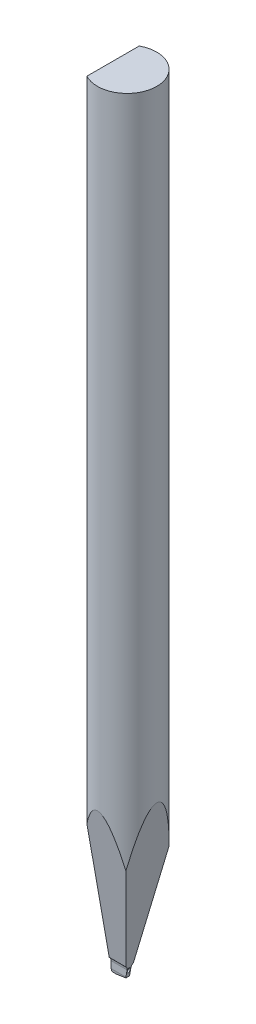
from build123d import *

# Parameters (mm, degrees)
TD_SKETCH_R                             = 0.79248
TL_FEATURE_DEPTH                        = 21.0312
TDF_STD_SKETCH_W                        = 2.09296
TDF_STD_SKETCH_H                        = 2.09296
TDF_STD_FEATURE_DEPTH                   = 22.061040395
ISA_20_STD_FEATURE_DEPTH                = 22.061040395
ISA_20_STD_FEATURE_DEPTH_BACK           = 22.061040395
VW_STD_FEATURE_DEPTH                    = 22.061040395
VW_STD_FEATURE_DEPTH_BACK               = 22.061040395
F_10BA_STD_FEATURE_DEPTH                = 22.061040503
F_10BA_STD_FEATURE_DEPTH_BACK           = 22.061040503
FRO_STD_FEATURE_DEPTH                   = 22.061040395
FRO_STD_FEATURE_DEPTH_BACK              = 22.061040395
C_STD_FEATURE_DEPTH                     = 22.061040395
C_STD_FEATURE_DEPTH_BACK                = 22.061040395
ERW_STD_FEATURE_DEPTH                   = 0.0254
H_STD_FEATURE_REACH                     = 22.896
H_STD_SKETCH_R                          = 0.01905
H_STD_SKETCH_3_R                        = 0.01905
FUNNEL_FINAL_DIAMETRE_STD_FEATURE_DEPTH = 2.499995
FUNNEL_FINAL_DIAMETRE_STD_FEATURE_DRAFT = -22.5
ROUND_BR_STD_FEATURE_START              = -1
ROUND_BR_STD_FEATURE_DEPTH              = 1.009339363
CBRA_STD_FEATURE_DEPTH                  = 0.00635


with BuildPart() as part:
    # TD_sketch → TL_feature (new body)
    with BuildSketch(Plane(origin=(0, 0, 0), x_dir=(1, 0, 0), z_dir=(0, 1, 0))):
        with Locations(Location((0, 0, 0), (0, 0, 270))):
            Circle(TD_SKETCH_R)
    extrude(amount=TL_FEATURE_DEPTH)

    # TDF_STD_sketch → TDF_STD_feature (cut, through all)
    with BuildSketch(Plane(origin=(0, 0, 0), x_dir=(1, 0, 0), z_dir=(0, 1, 0))):
        with Locations((-1.4224, 0)):
            Rectangle(TDF_STD_SKETCH_W, TDF_STD_SKETCH_H)
    extrude(amount=TDF_STD_FEATURE_DEPTH, mode=Mode.SUBTRACT)

    # ISA_20_STD_sketch → ISA_20_STD_feature (cut, two sides: drawn at the far end of the back side and taken through both)
    with BuildSketch(Plane(origin=(0, 0, 0), x_dir=(0, 0, -1), z_dir=(1, 0, 0)).offset(-ISA_20_STD_FEATURE_DEPTH_BACK)):
        Polygon((-12.955177728, 73.256388083), (-3.746467997, 21.0312), (-0.0381, 0), (0.0381, 0), (3.746467997, 21.0312), (12.955177728, 73.256388083), (12.955177728, -32.805303497), (-12.955177728, -32.805303497), align=None)
    extrude(amount=ISA_20_STD_FEATURE_DEPTH + ISA_20_STD_FEATURE_DEPTH_BACK, mode=Mode.SUBTRACT)

    # VW_STD_sketch → VW_STD_feature (cut, two sides: drawn at the far end of the back side and taken through both)
    with BuildSketch(Plane(origin=(0, 0, 0), x_dir=(0, 0, -1), z_dir=(1, 0, 0)).offset(-VW_STD_FEATURE_DEPTH_BACK)):
        with BuildLine():
            Line((-70.448918022, 70.704723144), (-20.775394878, 21.0312))
            Line((-20.775394878, 21.0312), (-0.087997439, 0.343802561))
            ThreePointArc((-0.087997439, 0.343802561), (-0.060467299, 0.302600796), (-0.0508, 0.254))
            Line((-0.0508, 0.254), (-0.0508, 0))
            Line((-0.0508, 0), (0.0508, 0))
            Line((0.0508, 0), (0.0508, 0.254))
            ThreePointArc((0.0508, 0.254), (0.060467299, 0.302600796), (0.087997439, 0.343802561))
            Line((0.087997439, 0.343802561), (20.775394878, 21.0312))
            Line((20.775394878, 21.0312), (70.448918022, 70.704723144))
            Line((70.448918022, 70.704723144), (70.448918022, -69.793217099))
            Line((70.448918022, -69.793217099), (-70.448918022, -69.793217099))
            Line((-70.448918022, -69.793217099), (-70.448918022, 70.704723144))
        make_face()
    extrude(amount=VW_STD_FEATURE_DEPTH + VW_STD_FEATURE_DEPTH_BACK, mode=Mode.SUBTRACT)

    # 10BA_STD_sketch → 10BA_STD_feature (cut, two sides: drawn at the far end of the back side and taken through both)
    with BuildSketch(Plane.XY.offset(-F_10BA_STD_FEATURE_DEPTH_BACK)):
        Polygon((-53.226091952, 0), (-0.37592, 0), (-0.25146, 0), (0.013312083, 0.046686462), (3.713447997, 21.0312), (12.890784046, 73.078459086), (91.272293968, 2.163710242), (25.155417971, -70.914748844), align=None)
    extrude(amount=F_10BA_STD_FEATURE_DEPTH + F_10BA_STD_FEATURE_DEPTH_BACK, mode=Mode.SUBTRACT)

    # FRO_STD_sketch → FRO_STD_feature (cut, two sides: drawn at the far end of the back side and taken through both)
    with BuildSketch(Plane.XY.offset(-FRO_STD_FEATURE_DEPTH_BACK)):
        with BuildLine():
            Line((-0.37592, 52.152138388), (-0.37592, 0.02794))
            ThreePointArc((-0.37592, 0.02794), (-0.367736563, 0.008183437), (-0.34798, 0))
            Line((-0.34798, 0), (51.776218388, 0))
            Line((51.776218388, 0), (-21.9385299, -73.714748288))
            Line((-21.9385299, -73.714748288), (-74.090668288, -21.5626099))
            Line((-74.090668288, -21.5626099), (-0.37592, 52.152138388))
        make_face()
    extrude(amount=FRO_STD_FEATURE_DEPTH + FRO_STD_FEATURE_DEPTH_BACK, mode=Mode.SUBTRACT)

    # C_STD_sketch → C_STD_feature (cut, two sides: drawn at the far end of the back side and taken through both)
    with BuildSketch(Plane(origin=(0, 0, 0), x_dir=(0, 0, -1), z_dir=(1, 0, 0)).offset(-C_STD_FEATURE_DEPTH_BACK)):
        with BuildLine():
            Line((-50.8957695, -11.2378876), (-0.027944581, 0))
            ThreePointArc((-0.027944581, 0), (0, 0.003050032), (0.027944581, 0))
            Line((0.027944581, 0), (50.8957695, -11.2378876))
            Line((50.8957695, -11.2378876), (50.8957695, -115.426672595))
            Line((50.8957695, -115.426672595), (-50.8957695, -115.426672595))
            Line((-50.8957695, -115.426672595), (-50.8957695, -11.2378876))
        make_face()
    extrude(amount=C_STD_FEATURE_DEPTH + C_STD_FEATURE_DEPTH_BACK, mode=Mode.SUBTRACT)


with BuildPart() as body_2:
    # ERW_STD_sketch → ERW_STD_feature (new, symmetric)
    with BuildSketch(Plane.XY):
        Polygon((-0.1397, 0.09144), (-0.1397, 0), (-0.32512, 0), (-0.272327091, 0.09144), align=None)
    extrude(amount=ERW_STD_FEATURE_DEPTH, both=True)

    # H_STD_sketch → H_STD_feature (add, up to next)
    with BuildSketch(Plane(origin=(-0.010357492, 0.166115932, 0), x_dir=(0, 0, -1), z_dir=(0.8660254037844415, 0.4999999999999953, 0)), mode=Mode.PRIVATE) as h_std_feature_sk1:
        with Locations(Location((0, 0, 0), (0, 0, 90))):
            Circle(H_STD_SKETCH_R)
    h_std_feature_tool1 = extrude(h_std_feature_sk1.sketch, amount=-H_STD_FEATURE_REACH, mode=Mode.PRIVATE) - body_2.part
    add(h_std_feature_tool1.solids().sort_by_distance((-0.010357, 0.166116, 0))[0])


with BuildPart() as funnel_final_diametre_std_feature_tool:
    # H_STD_sketch<3> → funnel_final_diametre_STD_feature (with draft: the straight prism first)
    with BuildSketch(Plane(origin=(-0.010357492, 0.166115932, 0), x_dir=(0, 0, -1), z_dir=(0.8660254037844415, 0.4999999999999953, 0))):
        with Locations(Location((0, 0, 0), (0, 0, 90))):
            Circle(H_STD_SKETCH_3_R)
    extrude(amount=FUNNEL_FINAL_DIAMETRE_STD_FEATURE_DEPTH)
    # funnel_final_diametre_STD_feature: the draft: its side faces are tilted about the plane it starts from
    funnel_final_diametre_std_feature_sides = [funnel_final_diametre_std_feature_tool.faces().sort_by_distance(p)[0] for p in [
        (1.081697098, 0.774616898, 0),
    ]]
    draft(funnel_final_diametre_std_feature_sides, Plane(origin=(-0.010357492, 0.166115932, 0), x_dir=(0, 0, -1), z_dir=(0.8660254037844415, 0.4999999999999953, 0)), FUNNEL_FINAL_DIAMETRE_STD_FEATURE_DRAFT)


with BuildPart() as body_2_1:
    add(body_2.part)

    # funnel_final_diametre_STD_feature: add funnel_final_diametre_std_feature_tool
    add(funnel_final_diametre_std_feature_tool.part)

    # ROUND_BR_STD_feature: read off the stored shape, not the designer's step
    # ROUND_BR_STD_feature outline → ROUND_BR_STD_feature (cut)
    with BuildSketch(Plane(origin=(0, 0, 0), x_dir=(0.8660254037844362, -0.5000000000000042, 0), z_dir=(0.5000000000000042, 0.8660254037844363, 0)).offset(ROUND_BR_STD_FEATURE_START)):
        with BuildLine():
            Line((-0.281562179, -0.0254), (-0.256162179, -0.0254))
            ThreePointArc((-0.256162179, -0.0254), (-0.274122691, -0.017960512), (-0.281562179, 0))
            Line((-0.281562179, 0), (-0.281562179, -0.0254))
        make_face()
        with BuildLine():
            Line((-0.281562179, 0.0254), (-0.281562179, 0))
            ThreePointArc((-0.281562179, 0), (-0.274122691, 0.017960512), (-0.256162179, 0.0254))
            Line((-0.256162179, 0.0254), (-0.281562179, 0.0254))
        make_face()
    extrude(amount=ROUND_BR_STD_FEATURE_DEPTH, mode=Mode.SUBTRACT)


with BuildPart() as part_1:
    add(part.part)

    # COMBINE_STD_feature: cut body 2
    add(body_2_1.part, mode=Mode.SUBTRACT)

    # CBRA_STD_sketch → CBRA_STD_feature (cut, symmetric)
    with BuildSketch(Plane.XY):
        Polygon((-0.319782487, 0.009244844), (-0.345182487, 0), (-0.319782487, 0), align=None)
    extrude(amount=CBRA_STD_FEATURE_DEPTH, both=True, mode=Mode.SUBTRACT)


solid = part_1.part
